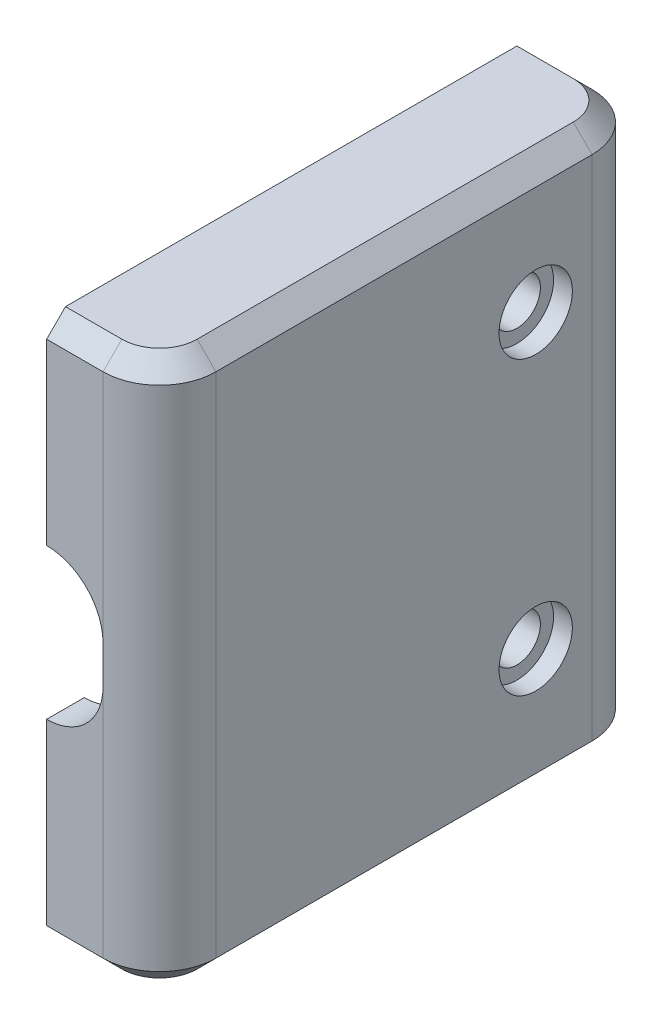
from build123d import *

# Parameters (mm, degrees)
SKETCH_1_W          = 26
SKETCH_1_H          = 29
EXTRUDE_1_DEPTH     = 6
SKETCH_2_R          = 1.25
CUT_EXTRUDE_1_DEPTH = 21.377683872
SKETCH_4_W          = 16
SKETCH_4_H          = 23
CUT_EXTRUDE_3_DEPTH = 2
CUT_EXTRUDE_4_DEPTH = 1.5
FILLET_1_R          = 1
SKETCH_6_R          = 1.95
CUT_EXTRUDE_5_DEPTH = 1
FILLET_3_R          = 3
SKETCH_8_W          = 6
SKETCH_8_H          = 21
CUT_EXTRUDE_6_DEPTH = 3.5
FILLET_2_R          = 1
FILLET_4_R          = 1
CUT_EXTRUDE_7_REACH = 30.675
SKETCH_9_W          = 6
SKETCH_9_H          = 8
FILLET_5_R          = 3
CHAMFER_2_SIZE      = 1


# Some blends are built 0.0001 mm under size
with BuildPart() as part:
    # Эскиз1 → Бобышка-Вытянуть1 (new body)
    with BuildSketch(Plane(origin=(0, 0, 0), x_dir=(0, 0, -1), z_dir=(1, 0, 0))):
        Rectangle(SKETCH_1_W, SKETCH_1_H)
    extrude(amount=EXTRUDE_1_DEPTH)

    # Эскиз2 → Вырез-Вытянуть1 (cut, through all)
    with BuildSketch(Plane.ZY):
        with Locations((-7, 7.75)):
            Circle(SKETCH_2_R)
        with Locations((-7, -7.75)):
            Circle(SKETCH_2_R)
    extrude(amount=-CUT_EXTRUDE_1_DEPTH, mode=Mode.SUBTRACT)

    # Эскиз4 → Вырез-Вытянуть3 (cut)
    with BuildSketch(Plane.ZY):
        with Locations((-3, 0)):
            Rectangle(SKETCH_4_W, SKETCH_4_H)
    extrude(amount=-CUT_EXTRUDE_3_DEPTH, mode=Mode.SUBTRACT)

    # Эскиз5 → Вырез-Вытянуть4 (cut)
    with BuildSketch(Plane.ZY.offset(-2)):
        Polygon((-11, -3.5), (-11, 3.5), (-6, 3.5), (-6, 10.5), (5, 10.5), (5, -10.5), (-6, -10.5), (-6, -3.5), align=None)
    extrude(amount=-CUT_EXTRUDE_4_DEPTH, mode=Mode.SUBTRACT)

    # Скругление1
    fillet_1_edges = [part.edges().sort_by_distance(p)[0] for p in [
        (2.75, 7, -6),
        (2.75, 3.5, -6),
        (2.75, 8.5, -6),
        (2.75, -8.5, -6),
        (2.75, -7, -6),
        (2.75, 3.5, -11),
        (2.75, -3.5, -6),
        (2.75, -3.5, -11),
    ]]
    fillet(fillet_1_edges, radius=FILLET_1_R)

    # Эскиз6 → Вырез-Вытянуть5 (cut)
    with BuildSketch(Plane(origin=(6, 0, 0), x_dir=(0, 0, -1), z_dir=(1, 0, 0))):
        with Locations((7, 7.75)):
            Circle(SKETCH_6_R)
        with Locations((7, -7.75)):
            Circle(SKETCH_6_R)
    extrude(amount=-CUT_EXTRUDE_5_DEPTH, mode=Mode.SUBTRACT)

    # Скругление3
    fillet_3_edges = [part.edges().sort_by_distance(p)[0] for p in [
        (6, 0, 13),
        (6, 0, -13),
    ]]
    fillet(fillet_3_edges, radius=FILLET_3_R)

    # Эскиз8 → Вырез-Вытянуть6 (cut)
    with BuildSketch(Plane.ZY):
        with Locations((8, 0)):
            Rectangle(SKETCH_8_W, SKETCH_8_H)
    extrude(amount=-CUT_EXTRUDE_6_DEPTH, mode=Mode.SUBTRACT)

    # Скругление2
    fillet_2_edges = [part.edges().sort_by_distance(p)[0] for p in [
        (1, -11.5, -11),
        (1, -11.5, 5),
        (2.75, -10.5, -6),
        (1, 11.5, -11),
        (1, 11.5, 5),
        (2.75, 10.5, -6),
        (1.75, -10.5, 11),
        (1.75, 10.5, 11),
    ]]
    fillet(fillet_2_edges, radius=FILLET_2_R - 0.0001)  # a hair under: the kernel refuses the full size

    # Скругление4
    # the kernel refuses this fillet: 1 mm, written as the material it takes off along each edge
    with BuildSketch(Plane(origin=(-1.830232679, -10.5, 5), x_dir=(0, 0, 1), z_dir=(1, 0, 0))) as fillet_4_piece_1:
        with BuildLine():
            CenterArc((0.732093072, 1), FILLET_4_R, 209.998345944, 60.001654056)
            Line((-0.133946766, 0.500025001), (-0.22055075, 0.450027501))
            ThreePointArc((-0.22055075, 0.450027501), (-0.1, 0.0001), (-0.1, 0))
            Line((-0.1, 0), (0, -0.1))
            Line((0, -0.1), (0.732093072, -0.1))
            Line((0.732093072, -0.1), (0.732093072, 0))
        make_face()
    extrude(amount=3.830232679, mode=Mode.SUBTRACT)
    with BuildSketch(Plane(origin=(-1.830232679, 10.5, 5), x_dir=(0, 0, 1), z_dir=(1, 0, 0))) as fillet_4_piece_2:
        with BuildLine():
            CenterArc((0.732093072, -1), FILLET_4_R, 90, 60.001654056)
            Line((-0.133946766, -0.500025001), (-0.22055075, -0.450027501))
            ThreePointArc((-0.22055075, -0.450027501), (-0.1, -0.0001), (-0.1, 0))
            Line((-0.1, 0), (0, 0.1))
            Line((0, 0.1), (0.732093072, 0.1))
            Line((0.732093072, 0.1), (0.732093072, 0))
        make_face()
    extrude(amount=3.830232679, mode=Mode.SUBTRACT)

    # Эскиз9 → Вырез-Вытянуть7 (cut, up to next)
    with BuildSketch(Plane(origin=(0, 0, 11), x_dir=(-1, 0, 0), z_dir=(0, 0, -1)), mode=Mode.PRIVATE) as cut_extrude_7_sk1:
        Rectangle(SKETCH_9_W, SKETCH_9_H)
    cut_extrude_7_tool1 = extrude(cut_extrude_7_sk1.sketch, amount=-CUT_EXTRUDE_7_REACH, mode=Mode.PRIVATE) & part.part
    add(cut_extrude_7_tool1.solids().sort_by_distance((0, 0, 11))[0], mode=Mode.SUBTRACT)

    # Скругление5
    fillet_5_edges = [part.edges().sort_by_distance(p)[0] for p in [
        (3, -4, 12),
        (3, 4, 12),
    ]]
    fillet(fillet_5_edges, radius=FILLET_5_R - 0.0001)  # a hair under: the kernel refuses the full size

    # Фаска2
    chamfer_2_edges = [part.edges().sort_by_distance(p)[0] for p in [
        (6, 14.5, 0),
        (6, -14.5, 0),
        (1.5, -14.5, -13),
        (1.5, -14.5, 13),
        (5.121320344, -14.5, -12.121320344),
        (5.121320344, -14.5, 12.121320344),
        (1.5, 14.5, 13),
        (1.5, 14.5, -13),
        (5.121320344, 14.5, -12.121320344),
        (5.121320344, 14.5, 12.121320344),
    ]]
    chamfer(chamfer_2_edges, length=CHAMFER_2_SIZE)


solid = part.part
